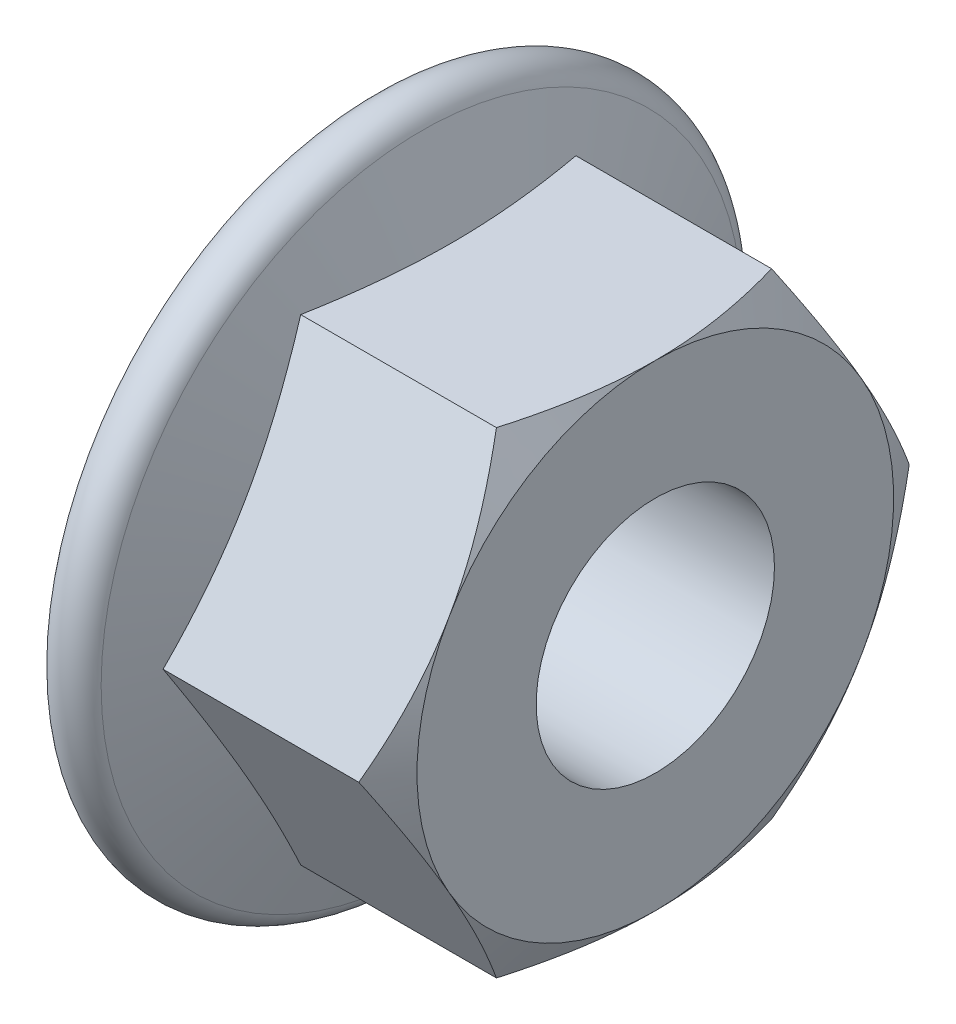
from build123d import *

# Parameters (mm, degrees)
SKETCH1_R      = 2.5
EXTRUDE1_DEPTH = 6


# Read off the part's stored shape, not the designer's step: Cut-Extrude1
with BuildPart() as part:
    # Sketch1 → Extrude1 (new body)
    with BuildSketch(Plane(origin=(0, 0, 0), x_dir=(0, 0, -1), z_dir=(1, 0, 0))):
        Polygon((5.773502692, 0), (2.886751346, 5), (-2.886751346, 5), (-5.773502692, 0), (-2.886751346, -5), (2.886751346, -5), align=None)
        Circle(SKETCH1_R, mode=Mode.SUBTRACT)
    extrude(amount=EXTRUDE1_DEPTH)

    # Cut-Extrude1 outline → Cut-Extrude1 (revolve, cut)
    with BuildSketch(Plane.YX):
        Polygon((5.773502692, 6.000000845), (4.999998834, 6.000000845), (5.773502688, 5.553418015), align=None)
    revolve(axis=Axis((0, 0, 0), (1, 0, 0)), mode=Mode.SUBTRACT)

    # Sketch3 → Revolve1 (revolve)
    with BuildSketch(Plane.XY, mode=Mode.PRIVATE) as revolve1_sk:
        with BuildLine():
            Line((0, 2.5), (0, 6.532899838))
            ThreePointArc((0, 6.532899838), (0.468624253, 7.091384474), (1.1, 6.726859517))
            Line((1.1, 6.726859517), (2.638451048, 2.5))
            Line((2.638451048, 2.5), (0, 2.5))
        make_face()
    revolve(revolve1_sk.sketch.rotate(Axis((0, 0, 0), (1, 0, 0)), 90), axis=Axis((0, 0, 0), (1, 0, 0)))


solid = part.part
